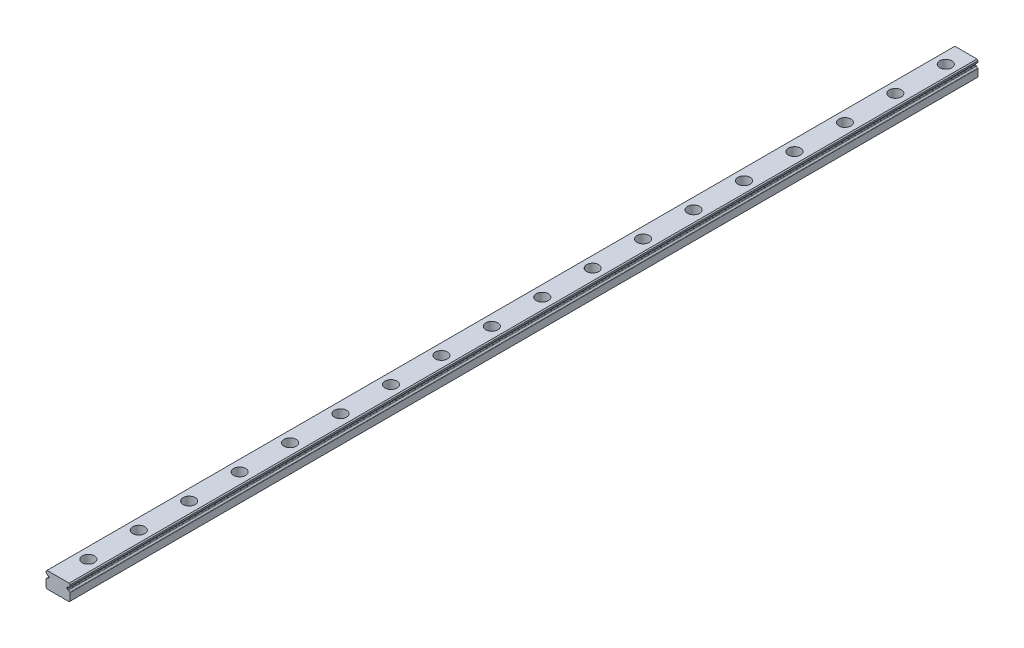
from build123d import *
from OCP.BRepAlgoAPI import BRepAlgoAPI_Cut
from OCP.TopTools import TopTools_ListOfShape

# Parameters (mm, degrees)
DODANIE_WYCI_GNI_CIE1_DEPTH                          = 450
WYTNIJ_WYCI_GNI_CIE1_DEPTH                           = 500
WYTNIJ_WYCI_GNI_CIE2_DEPTH                           = 451.073369942
WYTNIJ_WYCI_GNI_CIE3_DEPTH                           = 451.073369942
WYTNIJ_WYCI_GNI_CIE4_DEPTH                           = 451.073369942
POG_BIENIE_WALCOWE_POD_M3_WKR_T_DO_CZ_CI_D           = 3.5
POG_BIENIE_WALCOWE_POD_M3_WKR_T_DO_CZ_CI_CBORE_D     = 6
POG_BIENIE_WALCOWE_POD_M3_WKR_T_DO_CZ_CI_CBORE_DEPTH = 4.5
SFAZOWANIE1_SIZE                                     = 0.498527853
ZAOKR_GLENIE1_R                                      = 0.249335453


with BuildPart() as part:
    # Szkic1 → Dodanie-wyciągnięcie1 (new body)
    with BuildSketch(Plane(origin=(0, 0, -250), x_dir=(-1, 0, 0), z_dir=(0, 0, -1))):
        with BuildLine():
            Line((4.486751147, 0.453953201), (5.982321903, 0.584798688))
            Line((5.982321903, 0.584798688), (5.982321903, 2.00145917))
            Line((5.982321903, 2.00145917), (5.483807026, 2.499999999))
            Line((5.483807026, 2.499999999), (-5.483807025, 2.499999999))
            Line((-5.483807025, 2.499999999), (-5.982321902, 2.00145917))
            Line((-5.982321902, 2.00145917), (-5.982301511, 0.584796904))
            Line((-5.982301511, 0.584796904), (-4.486751147, 0.453953201))
            Line((-4.486751147, 0.453953201), (-4.486751147, -0.453953201))
            Line((-4.486751147, -0.453953201), (-5.982334878, -0.584799823))
            Line((-5.982334878, -0.584799823), (-5.982334878, -5.5))
            Line((-5.982334878, -5.5), (5.982334879, -5.5))
            Line((5.982334879, -5.5), (5.982334879, -1.174667145))
            ThreePointArc((5.982334879, -1.174667145), (5.514031688, -0.934125373), (5.194313534, -0.515856889))
            Line((5.194313534, -0.515856889), (4.486751147, -0.453953201))
            Line((4.486751147, -0.453953201), (4.486751147, 0.453953201))
        make_face()
    extrude(amount=-DODANIE_WYCI_GNI_CIE1_DEPTH)

    # Szkic2 → Wytnij-wyciągnięcie1 (cut)
    with BuildSketch(Plane(origin=(0, 0, -250), x_dir=(-1, 0, 0), z_dir=(0, 0, -1))):
        with BuildLine():
            Line((-2.392933874, -5.499999999), (-1.595289228, -5.499999999))
            ThreePointArc((-1.595289228, -5.499999999), (-1.994111551, -5.300588838), (-2.392933874, -5.499999999))
        make_face()
    extrude(amount=-WYTNIJ_WYCI_GNI_CIE1_DEPTH, mode=Mode.SUBTRACT)

    # Szkic3 → Wytnij-wyciągnięcie2 (cut, through all)
    with BuildSketch(Plane(origin=(0, 0, -250), x_dir=(-1, 0, 0), z_dir=(0, 0, -1))):
        with BuildLine():
            Line((-5.197193131, -0.516108821), (-5.982334878, -0.584799823))
            Line((-5.982334878, -0.584799823), (-5.982334878, -1.192732214))
            ThreePointArc((-5.982334878, -1.192732214), (-5.512694036, -0.943851138), (-5.197193131, -0.516108821))
        make_face()
    extrude(amount=-WYTNIJ_WYCI_GNI_CIE2_DEPTH, mode=Mode.SUBTRACT)


with BuildPart() as wytnij_wyci_gni_cie3_tool:
    # Szkic4 → Wytnij-wyciągnięcie3 (new, through all)
    with BuildSketch(Plane(origin=(0, 0, -250), x_dir=(-1, 0, 0), z_dir=(0, 0, -1))):
        with BuildLine():
            Line((-5.982301511, 1.142274645), (-5.982301511, 0.584796904))
            Line((-5.982301511, 0.584796904), (-5.210495168, 0.517272598))
            ThreePointArc((-5.210495168, 0.517272598), (-5.528487658, 0.913635578), (-5.982301511, 1.142274645))
        make_face()
    extrude(amount=-WYTNIJ_WYCI_GNI_CIE3_DEPTH)


with BuildPart() as part_1:
    add(part.part)

    # Wytnij-wyciągnięcie3: cut by wytnij_wyci_gni_cie3_tool, with a tolerance
    wytnij_wyci_gni_cie3_stock = TopTools_ListOfShape()
    wytnij_wyci_gni_cie3_stock.Append(part_1.part.wrapped)
    wytnij_wyci_gni_cie3_tools = TopTools_ListOfShape()
    wytnij_wyci_gni_cie3_tools.Append(wytnij_wyci_gni_cie3_tool.part.wrapped)
    wytnij_wyci_gni_cie3_cut = BRepAlgoAPI_Cut()
    wytnij_wyci_gni_cie3_cut.SetArguments(wytnij_wyci_gni_cie3_stock)
    wytnij_wyci_gni_cie3_cut.SetTools(wytnij_wyci_gni_cie3_tools)
    wytnij_wyci_gni_cie3_cut.SetFuzzyValue(0.00001)
    wytnij_wyci_gni_cie3_cut.Build()
    add(Compound.cast(wytnij_wyci_gni_cie3_cut.Shape()).solids(), mode=Mode.REPLACE)

    # Szkic5 → Wytnij-wyciągnięcie4 (cut, through all)
    with BuildSketch(Plane.XY.offset(200)):
        with BuildLine():
            Line((-5.982321903, 0.584798688), (-5.210495171, 0.517272599))
            ThreePointArc((-5.210495171, 0.517272599), (-5.528496167, 0.913641047), (-5.982321903, 1.142277836))
            Line((-5.982321903, 1.142277836), (-5.982321903, 0.584798688))
        make_face()
    extrude(amount=-WYTNIJ_WYCI_GNI_CIE4_DEPTH, mode=Mode.SUBTRACT)

    # Pogłębienie walcowe pod M3 Wkręt do części metalowych z łbem sześciokątnym1 (through all)
    with Locations(Plane(origin=(0, 2.499999999, 0), x_dir=(1, 0, 0), z_dir=(0, 1, 0))):
        with Locations((0, 240), (0, -240), (0, 215), (0, 190), (0, 165), (0, 140), (0, 115), (0, 90), (0, 65), (0, 40), (0, 15), (0, -10), (0, -35), (0, -60), (0, -85), (0, -110), (0, -135), (0, -160), (0, -185), (0, -210)):
            CounterBoreHole(POG_BIENIE_WALCOWE_POD_M3_WKR_T_DO_CZ_CI_D / 2, POG_BIENIE_WALCOWE_POD_M3_WKR_T_DO_CZ_CI_CBORE_D / 2, POG_BIENIE_WALCOWE_POD_M3_WKR_T_DO_CZ_CI_CBORE_DEPTH)

    # Sfazowanie1
    sfazowanie1_edges = [part_1.edges().sort_by_distance(p)[0] for p in [
        (-5.982334879, -5.5, -25),
        (5.982334878, -5.5, -25),
    ]]
    chamfer(sfazowanie1_edges, length=SFAZOWANIE1_SIZE)

    # Zaokrąglenie1
    zaokr_glenie1_edges = [part_1.edges().sort_by_distance(p)[0] for p in [
        (4.486751147, -0.453953201, -25),
        (-5.982321903, 1.142277836, -25),
        (5.982334878, -1.192732214, -25),
        (-5.194313534, -0.515856889, -25),
        (4.486751147, 0.453953201, -25),
        (-4.486751147, -0.453953201, -25),
        (5.197193131, -0.516108821, -25),
        (-4.486751147, 0.453953201, -25),
        (-5.982334879, -1.174667145, -25),
        (-5.210495171, 0.517272599, -25),
        (5.210495168, 0.517272598, -25),
        (5.982301511, 1.142274645, -25),
    ]]
    fillet(zaokr_glenie1_edges, radius=ZAOKR_GLENIE1_R)


solid = part_1.part
